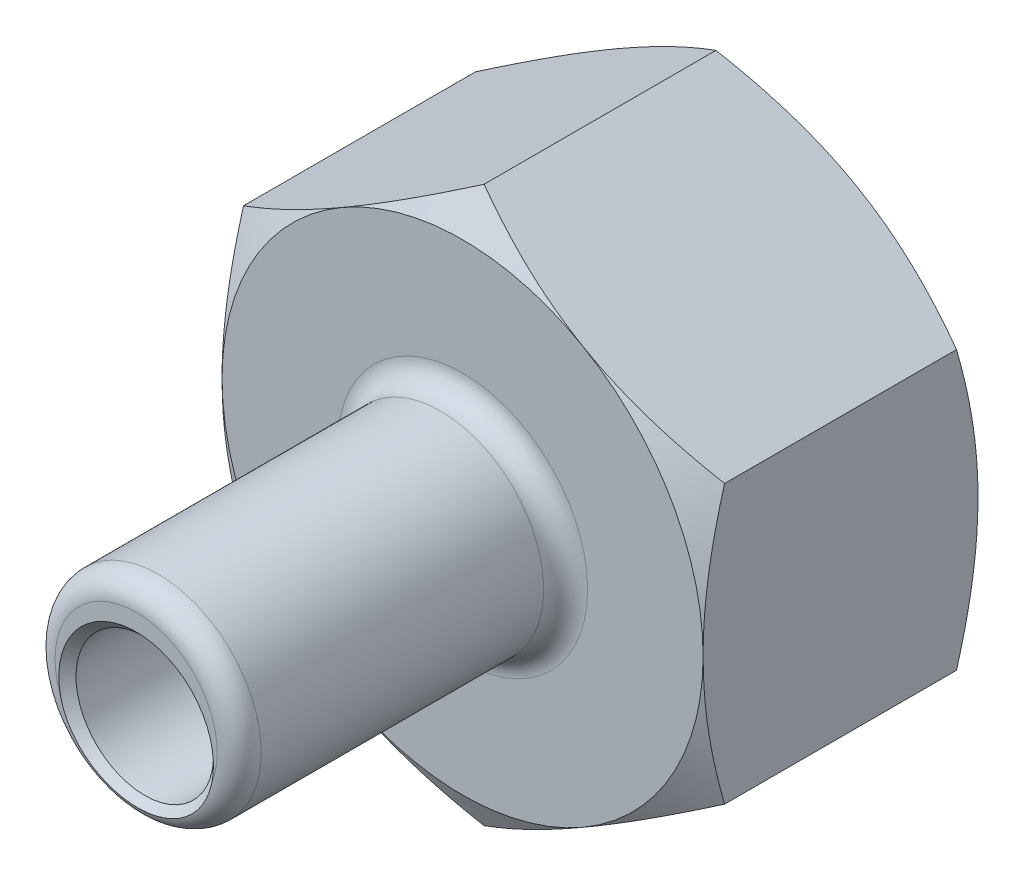
from build123d import *

# Parameters (mm, degrees)
HEX_EXTRUDE_DEPTH        = 6.35
SKETCH4_OUTSIDE_W        = 77.352
SKETCH4_OUTSIDE_H        = 79.072
SKETCH4_OUTSIDE_R        = 5.55625
HEX_CUT1_DEPTH           = 17.278326973
HEX_CUT1_DRAFT           = -60
SKETCH5_OUTSIDE_W        = 60.292
SKETCH5_OUTSIDE_H        = 62.012
SKETCH5_OUTSIDE_R        = 5.55625
HEX_CUT2_DEPTH           = 12.353215031
HEX_CUT2_DRAFT           = -60
SKETCH6_R                = 1.5875
ECCENTRIC_HOLE_CUT_DEPTH = 17.278326973
FILLET_2_R               = 0.508


with BuildPart() as part:
    # Sketch2 → Body Revolve (revolve)
    with BuildSketch(Plane(origin=(0, 0, 0), x_dir=(0, 0, -1), z_dir=(1, 0, 0)), mode=Mode.PRIVATE) as body_revolve_sk:
        Polygon((-6.9453125, 0), (6.9453125, 0), (6.9453125, 5.55625), (0.5953125, 5.55625), (0.5953125, 2.38125), (-6.9453125, 2.38125), align=None)
    revolve(body_revolve_sk.sketch.rotate(Axis((0, 0, 6.9453125), (0, 0, -1)), 90), axis=Axis((0, 0, 6.9453125), (0, 0, -1)))

    # Sketch3 → Hex Extrude (add)
    with BuildSketch(Plane(origin=(0, 0, -6.9453125), x_dir=(-1, 0, 0), z_dir=(0, 0, -1))):
        Polygon((0, 6.415804866), (-5.55625, 3.207902433), (-5.55625, -3.207902433), (0, -6.415804866), (5.55625, -3.207902433), (5.55625, 3.207902433), align=None)
    extrude(amount=-HEX_EXTRUDE_DEPTH)


with BuildPart() as hex_cut1_tool:
    # Sketch4 outside → Hex Cut1 (with draft: the straight prism first)
    with BuildSketch(Plane(origin=(0, 0, -6.9453125), x_dir=(-1, 0, 0), z_dir=(0, 0, -1))):
        Rectangle(SKETCH4_OUTSIDE_W, SKETCH4_OUTSIDE_H)
        Circle(SKETCH4_OUTSIDE_R, mode=Mode.SUBTRACT)
    extrude(amount=-HEX_CUT1_DEPTH)
    # Hex Cut1: the draft: its side faces are tilted about the plane it starts from
    hex_cut1_sides = [hex_cut1_tool.faces().sort_by_distance(p)[0] for p in [
        (0, -39.536, 1.693850986),
        (-38.676, 0, 1.693850986),
        (0, 39.536, 1.693850986),
        (38.676, 0, 1.693850986),
        (5.55625, 0, 1.693850986),
    ]]
    draft(hex_cut1_sides, Plane(origin=(0, 0, -6.9453125), x_dir=(-1, 0, 0), z_dir=(0, 0, -1)), HEX_CUT1_DRAFT)


with BuildPart() as part_1:
    add(part.part)

    # Hex Cut1: cut by hex_cut1_tool
    add(hex_cut1_tool.part, mode=Mode.SUBTRACT)


with BuildPart() as hex_cut2_tool:
    # Sketch5 outside → Hex Cut2 (with draft: the straight prism first)
    with BuildSketch(Plane.XY.offset(-0.5953125)):
        Rectangle(SKETCH5_OUTSIDE_W, SKETCH5_OUTSIDE_H)
        Circle(SKETCH5_OUTSIDE_R, mode=Mode.SUBTRACT)
    extrude(amount=-HEX_CUT2_DEPTH)
    # Hex Cut2: the draft: its side faces are tilted about the plane it starts from
    hex_cut2_sides = [hex_cut2_tool.faces().sort_by_distance(p)[0] for p in [
        (0, -31.006, -6.771920015),
        (30.146, 0, -6.771920015),
        (0, 31.006, -6.771920015),
        (-30.146, 0, -6.771920015),
        (-5.55625, 0, -6.771920015),
    ]]
    draft(hex_cut2_sides, Plane.XY.offset(-0.5953125), HEX_CUT2_DRAFT)


with BuildPart() as part_2:
    add(part_1.part)

    # Hex Cut2: cut by hex_cut2_tool
    add(hex_cut2_tool.part, mode=Mode.SUBTRACT)

    # Sketch6 → Eccentric Hole Cut (cut, through all)
    with BuildSketch(Plane.XY.offset(6.9453125)):
        with Locations((0, -0.3048)):
            Circle(SKETCH6_R)
    extrude(amount=-ECCENTRIC_HOLE_CUT_DEPTH, mode=Mode.SUBTRACT)

    # Fillet 2
    fillet_2_edges = [part_2.edges().sort_by_distance(p)[0] for p in [
        (-2.38125, 0, 6.9453125),
        (-2.38125, 0, -0.5953125),
    ]]
    fillet(fillet_2_edges, radius=FILLET_2_R)

    # Chamfer 2: read off the stored shape, not the designer's step
    # Chamfer 2 outline → Chamfer 2 (revolve, cut)
    with BuildSketch(Plane.XZ.offset(0.3048)):
        Polygon((1.5875, 6.945313993), (1.5875, 6.746875), (1.785938993, 6.945313993), align=None)
        Polygon((1.7859375, -6.9453125), (1.5875, -6.746875), (1.5875, -6.9453125), align=None)
    revolve(axis=Axis((0, -0.3048, 0), (0, 0, 1)), mode=Mode.SUBTRACT)


solid = part_2.part
